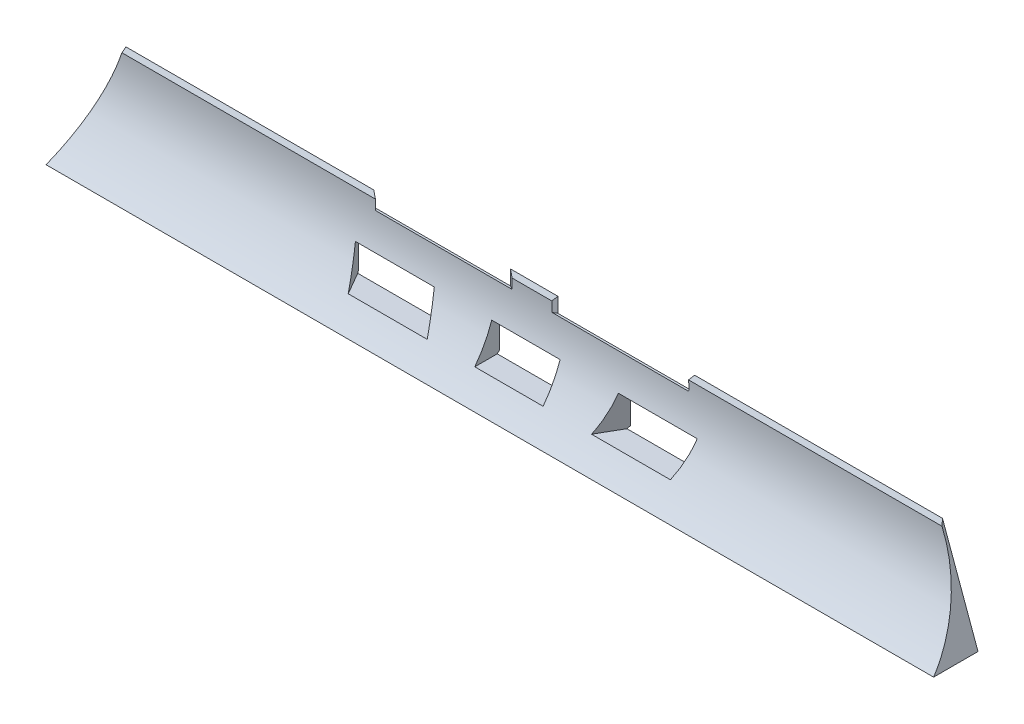
from build123d import *

# Parameters (mm, degrees)
BOSS_EXTRUDE1_DEPTH = 200
CUT_EXTRUDE1_DEPTH  = 202.45470955
CUT_EXTRUDE2_DEPTH  = 202.45470955
BOSS_EXTRUDE2_REACH = 203.455
SKETCH5_W           = 3
SKETCH5_H           = 5
CUT_EXTRUDE3_DEPTH  = 202.45470955
BOSS_EXTRUDE3_REACH = 203.455
SKETCH7_W           = 8
SKETCH7_H           = 13
CUT_EXTRUDE4_DEPTH  = 1.8
SKETCH9_W           = 15.4
SKETCH9_H           = 7.2
CUT_EXTRUDE6_DEPTH  = 202.45470955
CUT_EXTRUDE8_START  = -6.8
SKETCH10_W          = 15.4
SKETCH10_H          = 7.2
CUT_EXTRUDE8_DEPTH  = 22.6
SKETCH11_W          = 15.4
SKETCH11_H          = 8.8
CUT_EXTRUDE9_DEPTH  = 97.8


with BuildPart() as part:
    # Sketch1 → Boss-Extrude1 (new body)
    with BuildSketch(Plane(origin=(0, 0, 0), x_dir=(0, 0, -1), z_dir=(1, 0, 0))):
        Polygon((0, 0), (-10, 0), (0, 22), align=None)
    extrude(amount=BOSS_EXTRUDE1_DEPTH)

    # Sketch2 → Cut-Extrude1 (cut, through all)
    with BuildSketch(Plane(origin=(200, 0, 0), x_dir=(0, 0, -1), z_dir=(1, 0, 0))):
        with BuildLine():
            Line((-10, 0), (-0.5, 20.9))
            ThreePointArc((-0.5, 20.9), (-2.709071222, 9.295032374), (-10, 0))
        make_face()
    extrude(amount=-CUT_EXTRUDE1_DEPTH, mode=Mode.SUBTRACT)

    # Sketch4 → Cut-Extrude2 (cut, through all)
    with BuildSketch(Plane(origin=(200, 0, 0), x_dir=(0, 0, -1), z_dir=(1, 0, 0))):
        Polygon((-5, 0), (0, 5), (0, 0), align=None)
    extrude(amount=-CUT_EXTRUDE2_DEPTH, mode=Mode.SUBTRACT)

    # Boss-Extrude2: up to this face of the body (flat: up to its plane)
    boss_extrude2_end = Plane(part.part.faces().sort_by_distance((100, 2.5, 2.5))[0])
    # Sketch5 → Boss-Extrude2 (add, up to the picked face)
    with BuildSketch(Plane(origin=(0, 0, 0), x_dir=(-1, 0, 0), z_dir=(0, 0, -1)), mode=Mode.PRIVATE) as boss_extrude2_sk1:
        with Locations((-198.5, 2.5)):
            Rectangle(SKETCH5_W, SKETCH5_H)
    boss_extrude2_tool1 = split(extrude(boss_extrude2_sk1.sketch, amount=-BOSS_EXTRUDE2_REACH, mode=Mode.PRIVATE), bisect_by=boss_extrude2_end, keep=Keep.BOTH, mode=Mode.PRIVATE)
    boss_extrude2 = boss_extrude2_tool1.solids().sort_by(Axis((198.5, 2.5, 0), (0, 0, 1)))[0]
    add(boss_extrude2)

    # Sketch6 → Cut-Extrude3 (cut, through all)
    with BuildSketch(Plane(origin=(0, 0, 0), x_dir=(-1, 0, 0), z_dir=(0, 0, -1))):
        Polygon((-200, 22), (-191.992654846, 22), (-200, 0), align=None)
    cut_extrude3 = extrude(amount=-CUT_EXTRUDE3_DEPTH, mode=Mode.SUBTRACT)

    # Mirror2: Boss-Extrude2, Cut-Extrude3 across plane
    add(boss_extrude2.mirror(Plane(origin=(100, 0, 0), x_dir=(0, 0, 1), z_dir=(1, 0, 0))))
    add(cut_extrude3.mirror(Plane(origin=(100, 0, 0), x_dir=(0, 0, 1), z_dir=(1, 0, 0))), mode=Mode.SUBTRACT)

    # Sketch7 → Boss-Extrude3 (add, up to next)
    with BuildSketch(Plane(origin=(0, 0, 0), x_dir=(-1, 0, 0), z_dir=(0, 0, -1)), mode=Mode.PRIVATE) as boss_extrude3_sk1:
        with Locations((-163.831600122, 6.965)):
            Rectangle(SKETCH7_W, SKETCH7_H)
    boss_extrude3_tool1 = extrude(boss_extrude3_sk1.sketch, amount=-BOSS_EXTRUDE3_REACH, mode=Mode.PRIVATE) - part.part
    boss_extrude3 = boss_extrude3_tool1.solids().sort_by_distance((163.8316, 6.965, 0))[0]
    add(boss_extrude3)

    # Sketch8 → Cut-Extrude4 (cut)
    with BuildSketch(Plane(origin=(0, 0, 0), x_dir=(-1, 0, 0), z_dir=(0, 0, -1))):
        Polygon((-162.099549314, 8.5), (-165.56365093, 8.5), (-167.295701737, 5.5), (-165.56365093, 2.5), (-162.099549314, 2.5), (-160.367498507, 5.5), align=None)
    cut_extrude4 = extrude(amount=-CUT_EXTRUDE4_DEPTH, mode=Mode.SUBTRACT)

    # Mirror3: Boss-Extrude3, Cut-Extrude4 across plane
    add(boss_extrude3.mirror(Plane(origin=(100, 0, 0), x_dir=(0, 0, 1), z_dir=(1, 0, 0))))
    add(cut_extrude4.mirror(Plane(origin=(100, 0, 0), x_dir=(0, 0, 1), z_dir=(1, 0, 0))), mode=Mode.SUBTRACT)

    # Sketch9 → Cut-Extrude6 (cut, through all)
    with BuildSketch(Plane.XY):
        with Locations((99.915800061, 8.065)):
            Rectangle(SKETCH9_W, SKETCH9_H)
    extrude(amount=CUT_EXTRUDE6_DEPTH, mode=Mode.SUBTRACT)

    # Sketch10 → Cut-Extrude8 (cut)
    with BuildSketch(Plane(origin=(32.136000823, 0, -55.661186177), x_dir=(0.866025403784433, 0, 0.5000000000000099), z_dir=(-0.5000000000000098, 0, 0.8660254037844329)).offset(CUT_EXTRUDE8_START)):
        with Locations((113.139032853, 8.065)):
            Rectangle(SKETCH10_W, SKETCH10_H)
    cut_extrude8 = extrude(amount=CUT_EXTRUDE8_DEPTH, mode=Mode.SUBTRACT)

    # Sketch11 → Cut-Extrude9 (cut)
    with BuildSketch(Plane(origin=(115.669713788, 0, -66.781940393), x_dir=(0.4999999999999981, -1.9080601945838373e-15, 0.8660254037844397), z_dir=(-0.8660254037844397, 3.3048572009189827e-15, 0.4999999999999981))):
        with Locations((60.371690641, 23.065)):
            Rectangle(SKETCH11_W, SKETCH11_H)
    cut_extrude9 = extrude(amount=CUT_EXTRUDE9_DEPTH, mode=Mode.SUBTRACT)

    # Mirror4: Cut-Extrude8, Cut-Extrude9 across plane
    add(cut_extrude8.mirror(Plane(origin=(100, 0, 0), x_dir=(0, 0, 1), z_dir=(1, 0, 0))), mode=Mode.SUBTRACT)
    add(cut_extrude9.mirror(Plane(origin=(100, 0, 0), x_dir=(0, 0, 1), z_dir=(1, 0, 0))), mode=Mode.SUBTRACT)


solid = part.part
